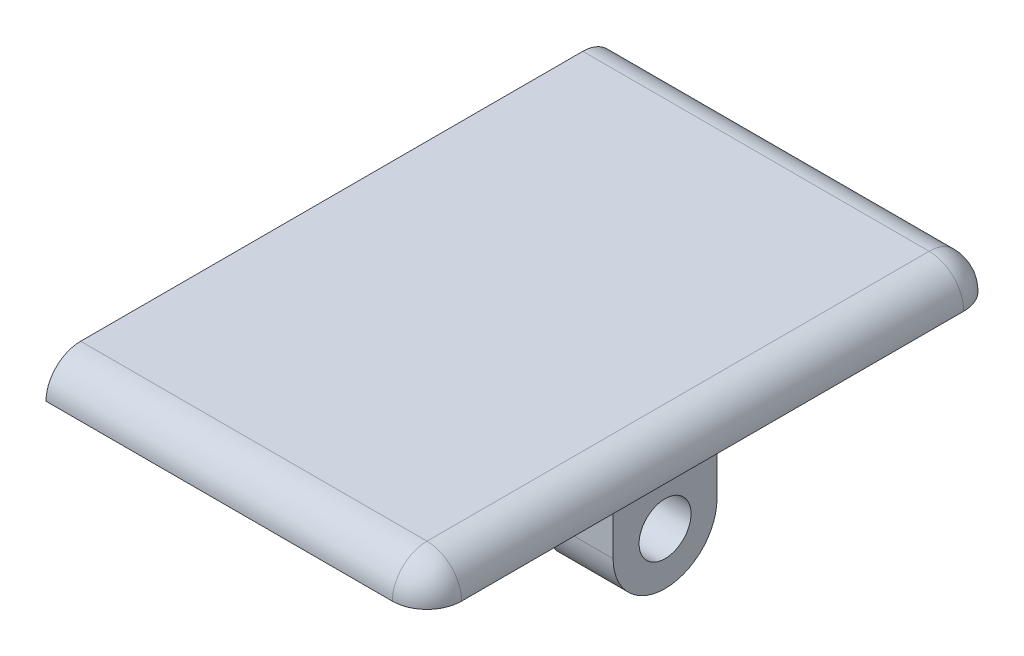
from build123d import *

# Parameters (mm, degrees)
SKETCH1_W           = 18.5
SKETCH1_H           = 27.5
BOSS_EXTRUDE1_DEPTH = 2
SKETCH3_R           = 1.5
BOSS_EXTRUDE2_DEPTH = 4
BOSS_EXTRUDE3_DEPTH = 2
FILLET1_R           = 2


with BuildPart() as part:
    # Sketch1 → Boss-Extrude1 (new body)
    with BuildSketch(Plane(origin=(0, 0, 0), x_dir=(1, 0, 0), z_dir=(0, 1, 0))):
        with Locations((-10, 14.5)):
            Rectangle(SKETCH1_W, SKETCH1_H)
    extrude(amount=-BOSS_EXTRUDE1_DEPTH)

    # Sketch3 → Boss-Extrude2 (add)
    with BuildSketch(Plane(origin=(-0.75, 0, 0), x_dir=(0, 0, -1), z_dir=(1, 0, 0))):
        with BuildLine():
            Line((11.5, -5), (11.5, -2))
            Line((11.5, -2), (17.5, -2))
            Line((17.5, -2), (17.5, -5))
            ThreePointArc((17.5, -5), (14.5, -8), (11.5, -5))
        make_face()
        with Locations((14.5, -5)):
            Circle(SKETCH3_R, mode=Mode.SUBTRACT)
    extrude(amount=-BOSS_EXTRUDE2_DEPTH)

    # Sketch4 → Boss-Extrude3 (add)
    with BuildSketch(Plane(origin=(0, 0, 0), x_dir=(1, 0, 0), z_dir=(0, 1, 0))):
        with BuildLine():
            Line((0, -2), (-20, -2))
            Line((-20, -2), (-20, 31))
            Line((-20, 31), (0, 31))
            ThreePointArc((0, 31), (1.414213562, 30.414213562), (2, 29))
            Line((2, 29), (2, 0))
            ThreePointArc((2, 0), (1.414213562, -1.414213562), (0, -2))
        make_face()
    extrude(amount=BOSS_EXTRUDE3_DEPTH)

    # Fillet1
    fillet1_edges = [part.edges().sort_by_distance(p)[0] for p in [
        (-10, 2, -31),
        (1.414213562, 2, -30.414213562),
        (2, 2, -14.5),
        (1.414213562, 2, 1.414213562),
        (-10, 2, 2),
    ]]
    fillet(fillet1_edges, radius=FILLET1_R - 0.0001)  # a hair under: the kernel refuses the full size


solid = part.part
